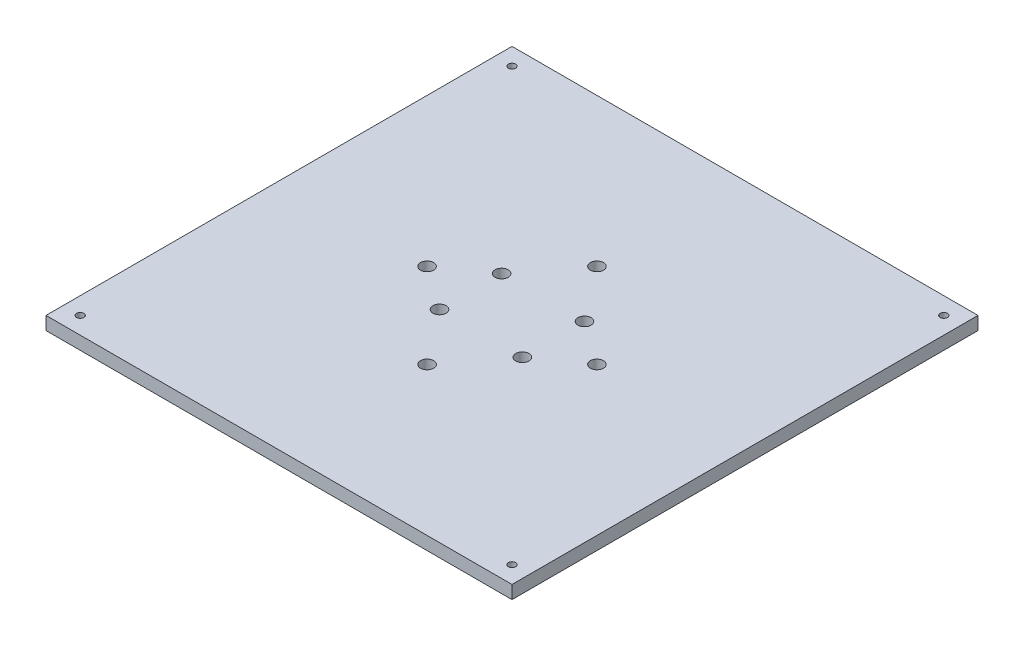
from build123d import *

# Parameters (mm, degrees)
SKETCH1_W           = 225
SKETCH1_H           = 225
BOSS_EXTRUDE1_DEPTH = 6.35
SKETCH2_R           = 1.75
CUT_EXTRUDE1_DEPTH  = 319.261405923
SKETCH3_R           = 3.175
CUT_EXTRUDE2_DEPTH  = 319.261405923


with BuildPart() as part:
    # Sketch1 → Boss-Extrude1 (new body)
    with BuildSketch(Plane(origin=(0, 0, 0), x_dir=(1, 0, 0), z_dir=(0, 1, 0))):
        with Locations((112.5, 112.5)):
            Rectangle(SKETCH1_W, SKETCH1_H)
    extrude(amount=BOSS_EXTRUDE1_DEPTH)

    # Sketch2 → Cut-Extrude1 (cut, through all)
    with BuildSketch(Plane(origin=(0, 6.35, 0), x_dir=(1, 0, 0), z_dir=(0, 1, 0))):
        with Locations((216.74, 216.74)):
            Circle(SKETCH2_R)
        with Locations((8.26, 216.74)):
            Circle(SKETCH2_R)
        with Locations((216.74, 8.26)):
            Circle(SKETCH2_R)
        with Locations((8.26, 8.26)):
            Circle(SKETCH2_R)
    extrude(amount=-CUT_EXTRUDE1_DEPTH, mode=Mode.SUBTRACT)

    # Sketch3 → Cut-Extrude2 (cut, through all)
    with BuildSketch(Plane(origin=(0, 6.35, 0), x_dir=(1, 0, 0), z_dir=(0, 1, 0))):
        with Locations((112.5, 71.490381)):
            Circle(SKETCH3_R)
        with Locations((153.509619, 112.5)):
            Circle(SKETCH3_R)
        with Locations((71.490381, 112.5)):
            Circle(SKETCH3_R)
        with Locations((112.5, 153.509619)):
            Circle(SKETCH3_R)
        with Locations((92.5, 97.5)):
            Circle(SKETCH3_R)
        with Locations((92.5, 127.5)):
            Circle(SKETCH3_R)
        with Locations((132.5, 127.5)):
            Circle(SKETCH3_R)
        with Locations((132.5, 97.5)):
            Circle(SKETCH3_R)
    extrude(amount=-CUT_EXTRUDE2_DEPTH, mode=Mode.SUBTRACT)


solid = part.part
